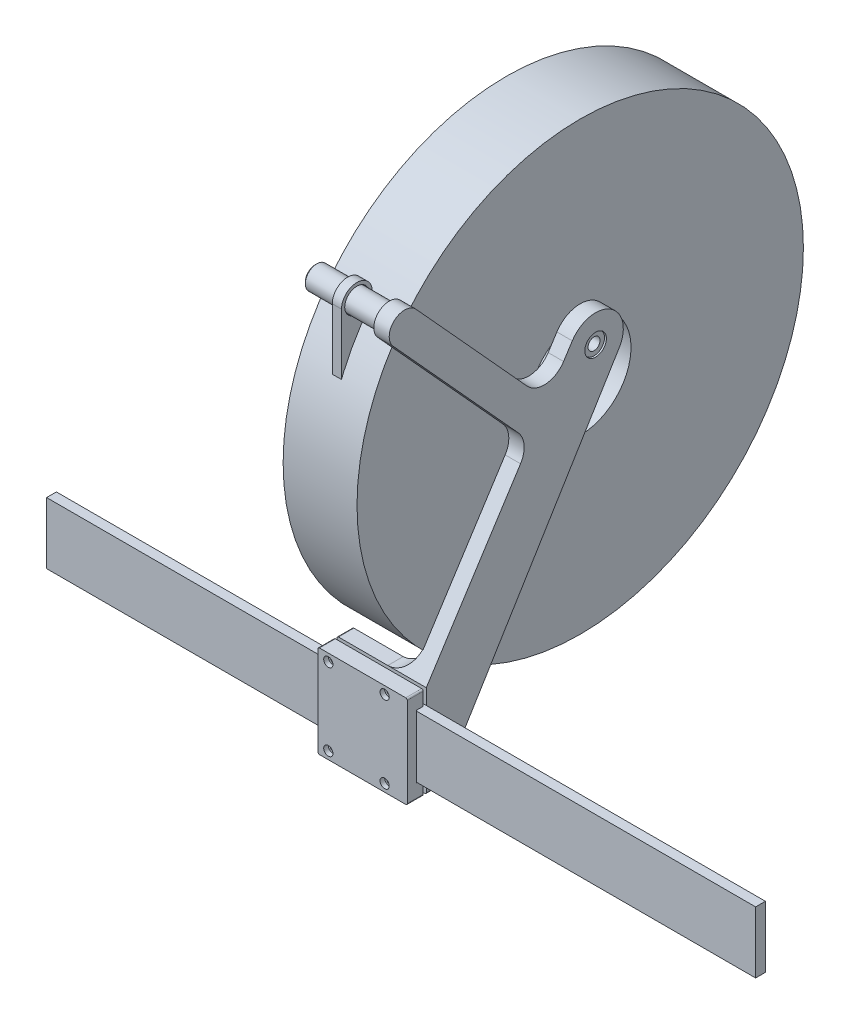
from build123d import *

# Parameters (mm, degrees)
SKETCH1_W                 = 460.622879588
SKETCH1_H                 = 40
BOSS_EXTRUDE1_DEPTH       = 6.35
SKETCH2_R                 = 10
SKETCH2_R_2               = 7.5
BOSS_EXTRUDE2_DEPTH       = 10
BOSS_EXTRUDE8_START       = -48
SKETCH2_2_R               = 7.5
BOSS_EXTRUDE8_DEPTH       = 58
SKETCH3_W                 = 10
SKETCH3_H                 = 60
BOSS_EXTRUDE3_DEPTH       = 48
SKETCH6_R                 = 145
SKETCH6_R_2               = 33
BOSS_EXTRUDE5_DEPTH       = 48
BOSS_EXTRUDE6_DEPTH       = 58
SKETCH8_R                 = 1.7
CUT_EXTRUDE2_DEPTH        = 457.748707497
FILLET1_R                 = 15
CUT_EXTRUDE3_START        = -2.5
CUT_EXTRUDE3_DEPTH        = 447.536439158
SKETCH10_R                = 3
CUT_EXTRUDE4_DEPTH        = 3
FILLET2_R                 = 15
FILLET4_R                 = 1
FILLET5_R                 = 1
BOSS_EXTRUDE7_START       = -10
BOSS_EXTRUDE7_OUTLINE_R   = 10
BOSS_EXTRUDE7_OUTLINE_R_2 = 7
BOSS_EXTRUDE7_DEPTH       = 10
CHAMFER1_SIZE             = 1
SKETCH13_R                = 3.9
CUT_EXTRUDE5_DEPTH        = 20
SKETCH14_R                = 7.9
SKETCH14_R_2              = 2.5
BOSS_EXTRUDE9_DEPTH       = 3
FILLET6_R                 = 1
CHAMFER2_SIZE             = 1
CHAMFER3_SIZE             = 1


# Read off the part's stored shape, not the designer's step: Boss-Extrude7
with BuildPart() as part:
    # Sketch1 → Boss-Extrude1 (new body)
    with BuildSketch(Plane.XY):
        Rectangle(SKETCH1_W, SKETCH1_H)
    extrude(amount=BOSS_EXTRUDE1_DEPTH)


with BuildPart() as body_2:
    # Sketch2 → Boss-Extrude2 (new body)
    with BuildSketch(Plane(origin=(0, 0, 0), x_dir=(0, 0, -1), z_dir=(1, 0, 0))):
        with BuildLine():
            Line((0, -30), (0, 30))
            Line((0, 30), (67.457194038, 135.058236459))
            Line((67.457194038, 135.058236459), (-21.482123399, 232.815836042))
            ThreePointArc((-21.482123399, 232.815836042), (-20.814889761, 246.942222673), (-6.68850313, 246.274989036))
            Line((-6.68850313, 246.274989036), (78.644445131, 152.481328057))
            Line((78.644445131, 152.481328057), (94.853527266, 177.725449281))
            ThreePointArc((94.853527266, 177.725449281), (119.559162816, 183.251964013), (125.355629783, 158.608267786))
            Line((125.355629783, 158.608267786), (10, -30))
            Line((10, -30), (0, -30))
        make_face()
        with Locations((110, 168)):
            Circle(SKETCH2_R, mode=Mode.SUBTRACT)
        with Locations((-14.085313264, 239.545412539)):
            Circle(SKETCH2_R_2, mode=Mode.SUBTRACT)
    extrude(amount=BOSS_EXTRUDE2_DEPTH)

    # Sketch2<2> → Boss-Extrude8 (add)
    with BuildSketch(Plane(origin=(0, 0, 0), x_dir=(0, 0, -1), z_dir=(1, 0, 0)).offset(BOSS_EXTRUDE8_START)):
        with Locations((-14.085313264, 239.545412539)):
            Circle(SKETCH2_2_R)
    extrude(amount=BOSS_EXTRUDE8_DEPTH)

    # Sketch3 → Boss-Extrude3 (add)
    with BuildSketch(Plane(origin=(0, 0, 0), x_dir=(0, 0, -1), z_dir=(1, 0, 0))):
        with Locations((5, 0)):
            Rectangle(SKETCH3_W, SKETCH3_H)
    extrude(amount=-BOSS_EXTRUDE3_DEPTH)


with BuildPart() as body_3:
    # Sketch6 → Boss-Extrude5 (new body)
    with BuildSketch(Plane.ZY):
        with Locations((-110, 145)):
            Circle(SKETCH6_R)
        with Locations((-110, 145)):
            Circle(SKETCH6_R_2, mode=Mode.SUBTRACT)
    extrude(amount=BOSS_EXTRUDE5_DEPTH)


with BuildPart() as body_4:
    # Sketch7 → Boss-Extrude6 (new body)
    with BuildSketch(Plane.ZY.offset(48)):
        Polygon((2, 30), (2, 20.5), (6.35, 20.5), (6.35, -20.5), (2, -20.5), (2, -30), (12.35, -30), (12.35, 30), align=None)
    extrude(amount=-BOSS_EXTRUDE6_DEPTH)


with BuildPart() as cut_extrude2_tool:
    # Sketch8 → Cut-Extrude2 (new, through all)
    with BuildSketch(Plane.XY.offset(12.35)):
        with Locations((-41.3, 25)):
            Circle(SKETCH8_R)
        with Locations((-4.7, 25)):
            Circle(SKETCH8_R)
    cut_extrude2 = extrude(amount=-CUT_EXTRUDE2_DEPTH)


with BuildPart() as body_2_1:
    add(body_2.part)

    # Cut-Extrude2: cut by cut_extrude2_tool
    add(cut_extrude2_tool.part, mode=Mode.SUBTRACT)

    # Fillet1
    # the kernel refuses this fillet: 15 mm, written as the material it adds along each edge
    with BuildSketch(Plane(origin=(0, 30, -10), x_dir=(0, 0, -1), z_dir=(0, -1, 0))) as fillet1_piece_1_section:
        with BuildLine():
            CenterArc((FILLET1_R, -FILLET1_R), FILLET1_R, 90, 90)
            Line((0, -FILLET1_R), (0, 0))
            Line((0, 0), (FILLET1_R, 0))
        make_face()
    fillet1_piece_1 = extrude(amount=60, mode=Mode.PRIVATE)
    fillet1_piece_1 = split(fillet1_piece_1, bisect_by=Plane(origin=(-3.567406216, -5.161085069, -25.191850859), z_dir=(0, 0.5217629007539379, 0.8530905434927976)), keep=Keep.TOP, mode=Mode.PRIVATE)
    fillet1_piece_1 = fillet1_piece_1 - Plane(origin=(-4.7, 25, -13.097259415), x_dir=(1, 0, 0), z_dir=(0, 0, 1)) * Cylinder(1.7, 180, mode=Mode.PRIVATE)
    add(fillet1_piece_1)
    with BuildSketch(Plane(origin=(0, 30, 0), x_dir=(0, 1, 0), z_dir=(0, 0, -1))) as fillet1_piece_2_section:
        with BuildLine():
            CenterArc((FILLET1_R, -FILLET1_R), FILLET1_R, 90, 90)
            Line((0, -FILLET1_R), (0, 0))
            Line((0, 0), (FILLET1_R, 0))
        make_face()
    fillet1_piece_2 = extrude(amount=10, mode=Mode.PRIVATE)
    fillet1_piece_2 = split(fillet1_piece_2, bisect_by=Plane(origin=(-3.899810015, 34.444685131, -2.853902725), z_dir=(0, -0.5403027378240759, -0.841470707452023)), keep=Keep.TOP, mode=Mode.PRIVATE)
    add(fillet1_piece_2)
    with BuildSketch(Plane(origin=(0, 30, 0), x_dir=(0, 1, 0), z_dir=(0, 0, -1))) as fillet1_piece_3a_section:
        with BuildLine():
            CenterArc((FILLET1_R, -FILLET1_R), FILLET1_R, 90, 90)
            Line((0, -FILLET1_R), (0, 0))
            Line((0, 0), (FILLET1_R, 0))
        make_face()
    fillet1_piece_3a = extrude(amount=47.5, mode=Mode.PRIVATE)
    fillet1_piece_3a = split(fillet1_piece_3a, bisect_by=Plane(origin=(-3.381337536, 24.454564435, -43.305223831), z_dir=(0, 0.5217629007539379, 0.8530905434927976)), keep=Keep.TOP, mode=Mode.PRIVATE)
    fillet1_piece_3a = split(fillet1_piece_3a, bisect_by=Plane(origin=(-3.381337536, 33.411569793, -10), z_dir=(0, 0, -1)), keep=Keep.TOP, mode=Mode.PRIVATE)
    with BuildSketch(Plane(origin=(0, 67.5, -10), x_dir=(0, 0, -1), z_dir=(0, -1, 0))) as fillet1_piece_3b_section:
        with BuildLine():
            CenterArc((FILLET1_R, -FILLET1_R), FILLET1_R, 90, 90)
            Line((0, -FILLET1_R), (0, 0))
            Line((0, 0), (FILLET1_R, 0))
        make_face()
    fillet1_piece_3b = extrude(amount=97.5, mode=Mode.PRIVATE)
    fillet1_piece_3b = split(fillet1_piece_3b, bisect_by=Plane(origin=(-2.935278618, 44.257987997, -9.154959148), z_dir=(0, -0.5403027378240759, -0.841470707452023)), keep=Keep.TOP, mode=Mode.PRIVATE)
    fillet1_piece_3b = split(fillet1_piece_3b, bisect_by=Plane(origin=(-2.935278618, 30, -14.174785424), z_dir=(0, 1, 0)), keep=Keep.TOP, mode=Mode.PRIVATE)
    fillet1_piece_3 = fillet1_piece_3a & fillet1_piece_3b
    add(fillet1_piece_3)

    # Sketch9 → Cut-Extrude3 (cut)
    with BuildSketch(Plane(origin=(0, 0, -10), x_dir=(-1, 0, 0), z_dir=(0, 0, -1)).offset(CUT_EXTRUDE3_START)):
        Polygon((3.054551733, 22.15), (6.345448267, 22.15), (7.990896534, 25), (6.345448267, 27.85), (3.054551733, 27.85), (1.409103466, 25), align=None)
        Polygon((39.654551733, 22.15), (42.945448267, 22.15), (44.590896534, 25), (42.945448267, 27.85), (39.654551733, 27.85), (38.009103466, 25), align=None)
    cut_extrude3 = extrude(amount=CUT_EXTRUDE3_DEPTH, mode=Mode.SUBTRACT)


with BuildPart() as body_4_1:
    add(body_4.part)

    # Cut-Extrude2: cut by cut_extrude2_tool
    add(cut_extrude2_tool.part, mode=Mode.SUBTRACT)


with BuildPart() as mirror1_tool:
    # Mirror1: Cut-Extrude2, Cut-Extrude3 across plane
    add(cut_extrude2.mirror(Plane.ZX))
    add(cut_extrude3.mirror(Plane.ZX))


with BuildPart() as body_2_2:
    add(body_2_1.part)

    # Mirror1: cut by mirror1_tool
    add(mirror1_tool.part, mode=Mode.SUBTRACT)

    # Fillet2
    fillet2_edges = [body_2_2.edges().sort_by_distance(p)[0] for p in [
        (5, 135.058236459, -67.457194038),
        (5, 152.481328057, -78.644445131),
    ]]
    fillet(fillet2_edges, radius=FILLET2_R)

    # Fillet4
    fillet4_edges = [body_2_2.edges().sort_by_distance(p)[0] for p in [
        (-48, 30, -5),
        (-48, -30, -5),
        (10, -30, -5),
    ]]
    fillet(fillet4_edges, radius=FILLET4_R)

    # Boss-Extrude7 outline → Boss-Extrude7 (add)
    with BuildSketch(Plane.ZY.offset(BOSS_EXTRUDE7_START)):
        with Locations((-110, 168)):
            Circle(BOSS_EXTRUDE7_OUTLINE_R)
        with Locations((-110, 168)):
            Circle(BOSS_EXTRUDE7_OUTLINE_R_2, mode=Mode.SUBTRACT)
    extrude(amount=BOSS_EXTRUDE7_DEPTH)

    # Chamfer2
    chamfer2_edges = [body_2_2.edges().sort_by_distance(p)[0] for p in [
        (-48, 239.545412539, 21.585313264),
    ]]
    chamfer(chamfer2_edges, length=CHAMFER2_SIZE)

    # Chamfer3
    chamfer3_edges = [body_2_2.edges().sort_by_distance(p)[0] for p in [
        (0, 239.545412539, 21.585313264),
    ]]
    chamfer(chamfer3_edges, length=CHAMFER3_SIZE)


with BuildPart() as body_4_2:
    add(body_4_1.part)

    # Mirror1: cut by mirror1_tool
    add(mirror1_tool.part, mode=Mode.SUBTRACT)

    # Sketch10 → Cut-Extrude4 (cut)
    with BuildSketch(Plane.XY.offset(12.35)):
        with Locations((-41.3, 25)):
            Circle(SKETCH10_R)
        with Locations((-4.7, 25)):
            Circle(SKETCH10_R)
        with Locations((-4.7, -25)):
            Circle(SKETCH10_R)
        with Locations((-41.3, -25)):
            Circle(SKETCH10_R)
    extrude(amount=-CUT_EXTRUDE4_DEPTH, mode=Mode.SUBTRACT)

    # Fillet5
    fillet5_edges = [body_4_2.edges().sort_by_distance(p)[0] for p in [
        (-48, -30, 7.175),
        (10, -30, 7.175),
        (10, 30, 7.175),
        (-48, 30, 7.175),
    ]]
    fillet(fillet5_edges, radius=FILLET5_R)


with BuildPart() as body_5:
    # Sketch12 → Revolve1 (revolve)
    with BuildSketch(Plane(origin=(0, 168, 0), x_dir=(1, 0, 0), z_dir=(0, 1, 0)), mode=Mode.PRIVATE) as revolve1_sk:
        Polygon((0, 120), (0, 116.8), (9, 116.8), (9, 110), (-54, 110), (-54, 125), (-50, 125), (-50, 120), align=None)
    revolve(revolve1_sk.sketch.rotate(Axis((-28.753745024, 168, -110), (1, 0, 0)), 180), axis=Axis((-28.753745024, 168, -110), (1, 0, 0)))

    # Chamfer1
    chamfer1_edges = [body_5.edges().sort_by_distance(p)[0] for p in [
        (-50, 168, -125),
        (-54, 168, -125),
    ]]
    chamfer(chamfer1_edges, length=CHAMFER1_SIZE)

    # Sketch13 → Cut-Extrude5 (cut)
    with BuildSketch(Plane(origin=(9, 0, 0), x_dir=(0, 0, -1), z_dir=(1, 0, 0))):
        with Locations((110, 168)):
            Circle(SKETCH13_R)
    extrude(amount=-CUT_EXTRUDE5_DEPTH, mode=Mode.SUBTRACT)


with BuildPart() as body_6:
    # Sketch14 → Boss-Extrude9 (new, symmetric)
    with BuildSketch(Plane.ZY.offset(24)):
        with BuildLine():
            Line((4.085313264, 239.545412539), (4.085313264, 162.5))
            ThreePointArc((4.085313264, 162.5), (14.085313264, 152.5), (24.085313264, 162.5))
            Line((24.085313264, 162.5), (24.085313264, 239.545412539))
            ThreePointArc((24.085313264, 239.545412539), (14.085313264, 249.545412539), (4.085313264, 239.545412539))
        make_face()
        with Locations((14.085313264, 239.545412539)):
            Circle(SKETCH14_R, mode=Mode.SUBTRACT)
        with Locations((14.085313264, 162.5)):
            Circle(SKETCH14_R_2, mode=Mode.SUBTRACT)
    extrude(amount=BOSS_EXTRUDE9_DEPTH, both=True)

    # Fillet6
    fillet6_edges = [body_6.edges().sort_by_distance(p)[0] for p in [
        (-21, 162.5, 11.585313264),
        (-27, 162.5, 11.585313264),
    ]]
    fillet(fillet6_edges, radius=FILLET6_R)


solid = Compound([part.part, body_3.part, body_2_2.part, body_4_2.part, body_5.part, body_6.part])
